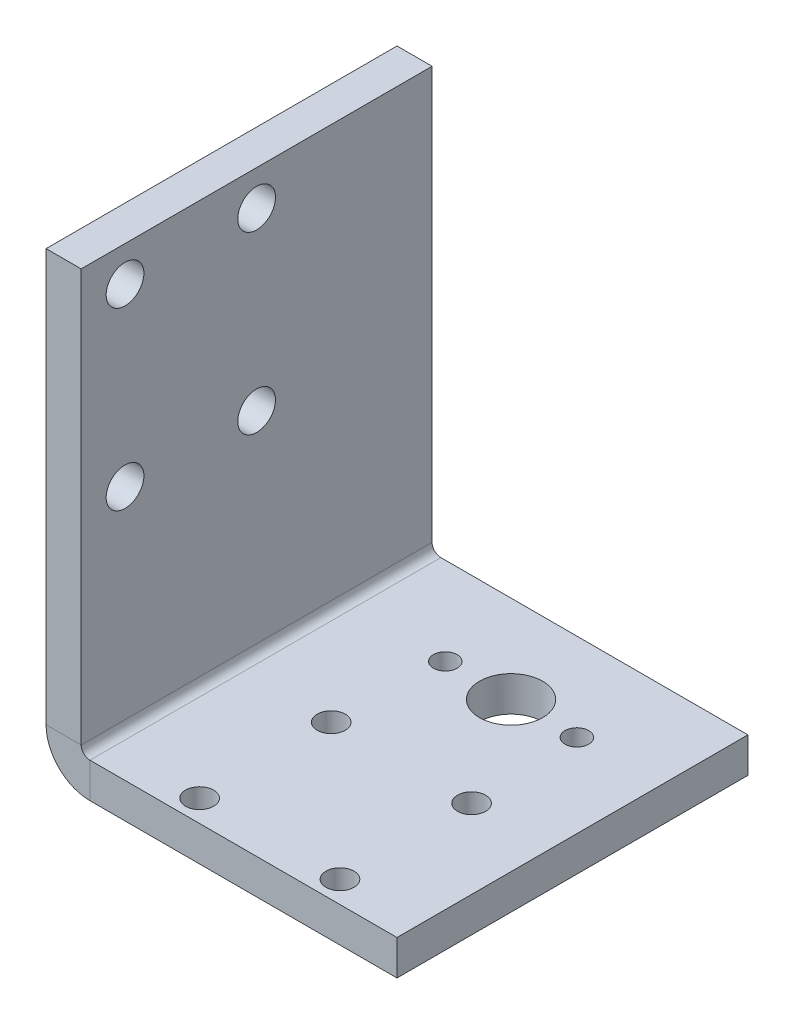
from build123d import *

# Parameters (mm, degrees)
SM_BASE_FLANGE_2_DEPTH = 20
HOLE_WIZARD_M3_1_D     = 3.2
SKETCH_24_R            = 3.6
CUT_EXTRUDE_2_DEPTH    = 67.332495807
HOLE_WIZARD_M4_1_D     = 4.3
HOLE_WIZARD_M2_5_1_D   = 2.7


# Sheet-metal steps are written as plain solids
with BuildPart() as part:
    # 草圖16 → 基材-凸緣2 (new, symmetric)
    with BuildSketch(Plane.XY):
        with BuildLine():
            Line((36, 0), (1, 0))
            ThreePointArc((1, 0), (0.292893219, 0.292893219), (0, 1))
            Line((0, 1), (0, 48))
            Line((0, 48), (-4, 48))
            Line((-4, 48), (-4, 1))
            ThreePointArc((-4, 1), (-2.535533906, -2.535533906), (1, -4))
            Line((1, -4), (36, -4))
            Line((36, -4), (36, 0))
        make_face()
    extrude(amount=SM_BASE_FLANGE_2_DEPTH, both=True)

    # M3 餘隙孔1 (through all)
    with Locations(Plane(origin=(0, 0, 0), x_dir=(-1, 0, 0), z_dir=(0, 1, 0))):
        with Locations((-27, 17.5), (-11, 2.5), (-11, 17.5), (-27, 2.5)):
            Hole(HOLE_WIZARD_M3_1_D / 2)

    # 草圖24 → 除料-伸長2 (cut, through all)
    with BuildSketch(Plane.XZ.offset(4)):
        with Locations(Location((19, -10, 0), (0, 0, 270))):
            Circle(SKETCH_24_R)
    extrude(amount=-CUT_EXTRUDE_2_DEPTH, mode=Mode.SUBTRACT)

    # M4 餘隙孔1 (through all)
    with Locations(Plane(origin=(0, 0, 0), x_dir=(0, 0, 1), z_dir=(1, 0, 0))):
        with Locations((0, -44), (15, -44), (15, -24), (0, -24)):
            Hole(HOLE_WIZARD_M4_1_D / 2)

    # M2.5 餘隙孔1 (through all)
    with Locations(Plane(origin=(0, -4, 0), x_dir=(-1, 0, 0), z_dir=(0, -1, 0))):
        with Locations((-11.5, 10), (-26.5, 10)):
            Hole(HOLE_WIZARD_M2_5_1_D / 2)


solid = part.part
